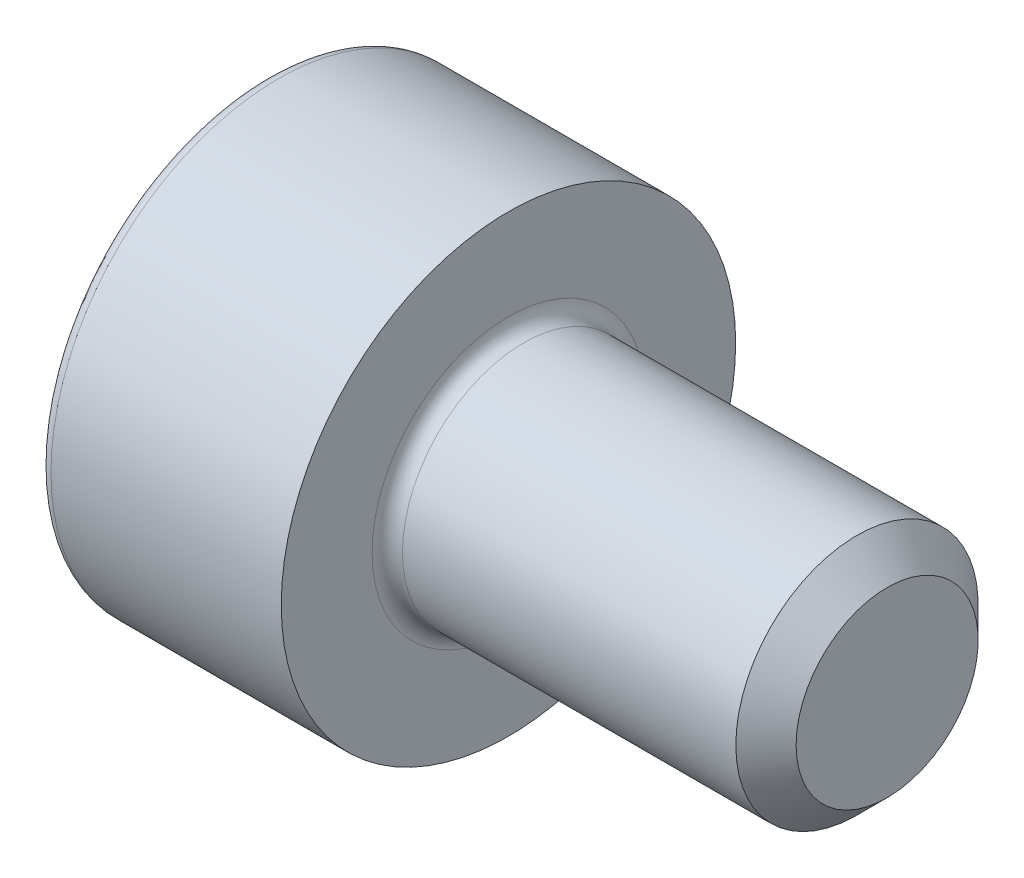
from build123d import *

# Parameters (mm, degrees)
FILLET1_R   = 0.1
FILLET2_R   = 0.08
HEX_2_DEPTH = 0.7


with BuildPart() as part:
    # BodySke → BaseBody (revolve)
    with BuildSketch(Plane.XY):
        Polygon((0, 0), (0, 1.5), (1.6, 1.5), (1.6, 0.8), (3.901, 0.8), (4.1, 0.601), (4.1, 0), align=None)
    revolve(axis=Axis((0, 0, 0), (1, 0, 0)))

    # Fillet1
    fillet1_edges = [part.edges().sort_by_distance(p)[0] for p in [
        (1.6, -0.8, 0),
    ]]
    fillet(fillet1_edges, radius=FILLET1_R)

    # Fillet2
    fillet2_edges = [part.edges().sort_by_distance(p)[0] for p in [
        (0, -1.5, 0),
    ]]
    fillet(fillet2_edges, radius=FILLET2_R)

    # HexSke → Hex 2 (cut)
    with BuildSketch(Plane(origin=(0, 0, 0), x_dir=(0, 0, -1), z_dir=(1, 0, 0))):
        Polygon((0, 0.866025404), (-0.75, 0.433012702), (-0.75, -0.433012702), (0, -0.866025404), (0.75, -0.433012702), (0.75, 0.433012702), align=None)
    extrude(amount=HEX_2_DEPTH, mode=Mode.SUBTRACT)

    # Hex-PreBroachSke → Hex-PreBroach (revolve, cut)
    with BuildSketch(Plane.XY):
        Polygon((0, 0), (0, 0.75), (0.7, 0.75), (1.133012702, 0), align=None)
    revolve(axis=Axis((0, 0, 0), (1, 0, 0)), mode=Mode.SUBTRACT)


solid = part.part
